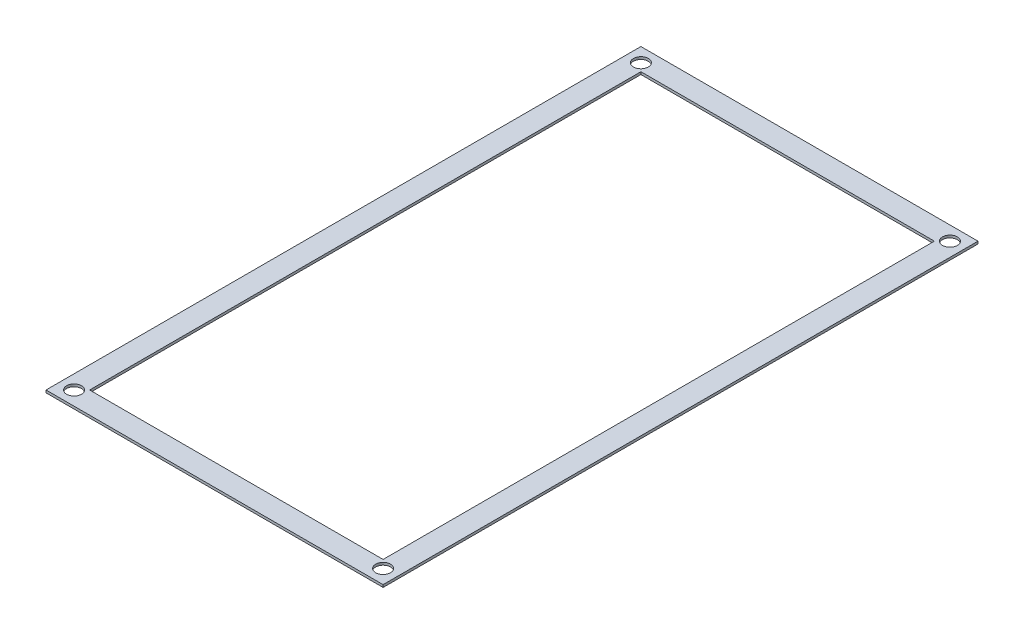
from build123d import *

# Parameters (mm, degrees)
SKETCH3_R           = 0.75
BOSS_EXTRUDE1_DEPTH = 0.25
SKETCH4_W           = 29.6
SKETCH4_H           = 55.6
CUT_EXTRUDE1_DEPTH  = 10


with BuildPart() as part:
    # Sketch3 → Boss-Extrude1 (new body)
    with BuildSketch(Plane(origin=(0, 0, 0), x_dir=(1, 0, 0), z_dir=(0, 1, 0))):
        Polygon((-17, 35.809268437), (-17, 26), (-17, -14.381463126), (-17, -24.190731563), (-7.190731563, -24.190731563), (7.190731563, -24.190731563), (17, -24.190731563), (17, -14.381463126), (17, 26), (17, 35.809268437), (7.190731563, 35.809268437), (-7.190731563, 35.809268437), align=None)
        with Locations((-15.585786438, -22.776518001)):
            Circle(SKETCH3_R, mode=Mode.SUBTRACT)
        with Locations((15.585786438, -22.776518001)):
            Circle(SKETCH3_R, mode=Mode.SUBTRACT)
        with Locations((-15.585786438, 34.395054875)):
            Circle(SKETCH3_R, mode=Mode.SUBTRACT)
        with Locations((15.585786438, 34.395054875)):
            Circle(SKETCH3_R, mode=Mode.SUBTRACT)
    extrude(amount=BOSS_EXTRUDE1_DEPTH)

    # Sketch4 → Cut-Extrude1 (cut)
    with BuildSketch(Plane(origin=(0, 0.25, 0), x_dir=(1, 0, 0), z_dir=(0, 1, 0))):
        with Locations((0, 5.809268437)):
            Rectangle(SKETCH4_W, SKETCH4_H)
    extrude(amount=-CUT_EXTRUDE1_DEPTH, mode=Mode.SUBTRACT)


solid = part.part
